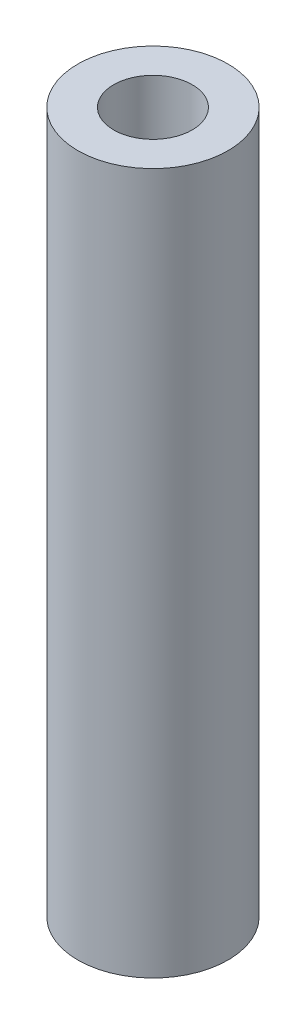
from build123d import *

# Parameters (mm, degrees)
SKETCH1_R           = 4.7625
SKETCH1_R_2         = 2.4892
BOSS_EXTRUDE1_DEPTH = 22.225


with BuildPart() as part:
    # Sketch1 → Boss-Extrude1 (new, symmetric)
    with BuildSketch(Plane(origin=(0, 0, 0), x_dir=(1, 0, 0), z_dir=(0, 1, 0))):
        Circle(SKETCH1_R)
        Circle(SKETCH1_R_2, mode=Mode.SUBTRACT)
    extrude(amount=BOSS_EXTRUDE1_DEPTH, both=True)


solid = part.part
